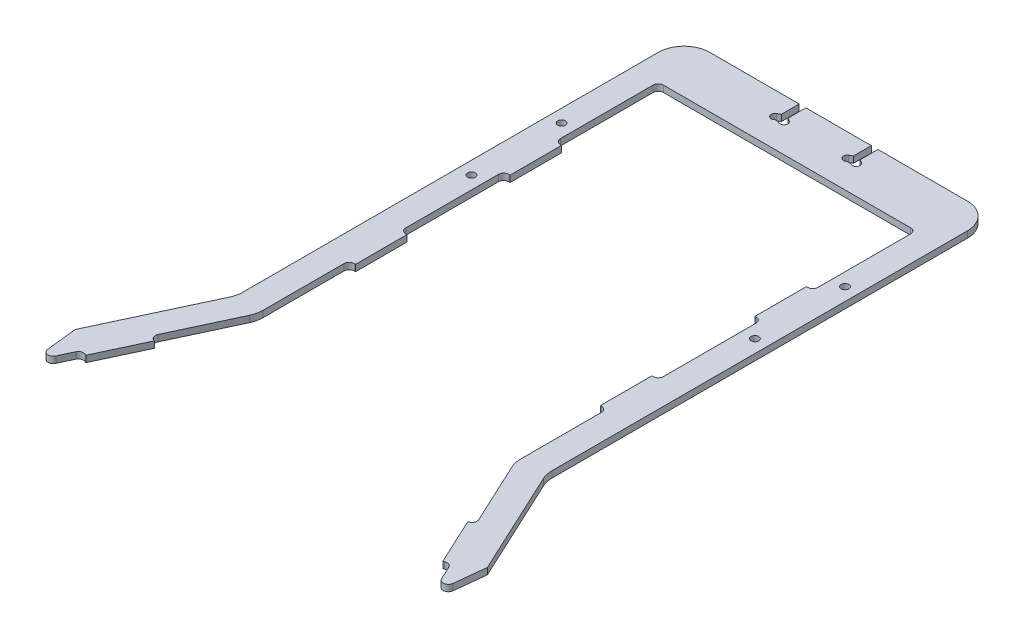
from build123d import *

# Parameters (mm, degrees)
BASE_FLANGE1_DEPTH    = 3.175
SKETCH7_W             = 3.302
SKETCH7_H             = 12.7
CUT_EXTRUDE1_DEPTH    = 326.126156068
SKETCH12_W            = 3.175
SKETCH12_H            = 25.4
TAB1_DEPTH            = 3.175
CUT_EXTRUDE2_DEPTH    = 326.126156068
FILLET1_R             = 2.54
CUT_EXTRUDE3_DEPTH    = 316.848888055
FILLET2_R             = 12.7
FILLET3_R             = 2.54
F_6_CLEARANCE_HOLE1_D = 3.7973


# Sheet-metal steps are written as plain solids
with BuildPart() as part:
    # Sketch1 → Base-Flange1 (new body)
    with BuildSketch(Plane(origin=(0, 0, 0), x_dir=(1, 0, 0), z_dir=(0, 1, 0))):
        Polygon((-76.2, 0), (76.2, 0), (76.2, -220.278764113), (113.110108895, -299.432748076), (101.6, -304.8), (63.5, -223.094286329), (63.5, -25.4), (-63.5, -25.4), (-63.5, -223.094286329), (-101.6, -304.8), (-113.110108895, -299.432748076), (-76.2, -220.278764113), align=None)
    extrude(amount=-BASE_FLANGE1_DEPTH)

    # Sketch7 → Cut-Extrude1 (cut, through all)
    with BuildSketch(Plane(origin=(0, 0, 0), x_dir=(1, 0, 0), z_dir=(0, 1, 0))):
        with Locations((-17.78, -6.35)):
            Rectangle(SKETCH7_W, SKETCH7_H)
        with Locations((17.78, -6.35)):
            Rectangle(SKETCH7_W, SKETCH7_H)
    extrude(amount=-CUT_EXTRUDE1_DEPTH, mode=Mode.SUBTRACT)

    # Sketch12 → Tab1 (add)
    with BuildSketch(Plane(origin=(0, 0, 0), x_dir=(1, 0, 0), z_dir=(0, 1, 0))):
        with Locations((-61.9125, -88.9)):
            Rectangle(SKETCH12_W, SKETCH12_H)
        Polygon((-80.130992304, -258.759564419), (-90.865496152, -281.779782209), (-87.987968928, -283.12159519), (-77.25346508, -260.1013774), align=None)
        with Locations((-61.9125, -165.1)):
            Rectangle(SKETCH12_W, SKETCH12_H)
        Polygon((77.25346508, -260.1013774), (87.987968928, -283.12159519), (90.865496152, -281.779782209), (80.130992304, -258.759564419), align=None)
        with Locations((61.9125, -165.1)):
            Rectangle(SKETCH12_W, SKETCH12_H)
        with Locations((61.9125, -88.9)):
            Rectangle(SKETCH12_W, SKETCH12_H)
    extrude(amount=-TAB1_DEPTH)

    # Sketch13 → Cut-Extrude2 (cut, through all)
    with BuildSketch(Plane(origin=(0, 0, 0), x_dir=(1, 0, 0), z_dir=(0, 1, 0))):
        Polygon((-101.6, -304.8), (-98.916374038, -299.044945552), (-101.6, -274.749239894), (-113.110108895, -299.432748076), align=None)
        Polygon((101.6, -304.8), (98.916374038, -299.044945552), (101.6, -274.749239894), (113.110108895, -299.432748076), align=None)
    extrude(amount=-CUT_EXTRUDE2_DEPTH, mode=Mode.SUBTRACT)

    # Fillet1
    fillet1_edges = [part.edges().sort_by_distance(p)[0] for p in [
        (63.5, -1.5875, 152.4),
        (63.5, -1.5875, 177.8),
        (80.130992304, -1.5875, 258.759564419),
        (90.865496152, -1.5875, 281.779782209),
        (-80.130992304, -1.5875, 258.759564419),
        (-90.865496152, -1.5875, 281.779782209),
        (-63.5, -1.5875, 177.8),
        (-63.5, -1.5875, 152.4),
        (-63.5, -1.5875, 101.6),
        (-63.5, -1.5875, 76.2),
        (63.5, -1.5875, 25.4),
        (-63.5, -1.5875, 25.4),
        (63.5, -1.5875, 76.2),
        (63.5, -1.5875, 101.6),
    ]]
    fillet(fillet1_edges, radius=FILLET1_R)

    # Sketch14 → Cut-Extrude3 (cut, through all)
    with BuildSketch(Plane(origin=(0, 0, 0), x_dir=(1, 0, 0), z_dir=(0, 1, 0))):
        with BuildLine():
            Line((-20.927228778, -9.663103241), (-19.431, -8.799255153))
            Line((-19.431, -8.799255153), (-19.431, -9.487125897))
            ThreePointArc((-19.431, -9.487125897), (-19.752208028, -13.204840809), (-20.927228778, -9.663103241))
        make_face()
        with BuildLine():
            Line((-16.129, -8.799255153), (-16.129, -9.487125897))
            ThreePointArc((-16.129, -9.487125897), (-15.807791972, -13.204840809), (-14.632771222, -9.663103241))
            Line((-14.632771222, -9.663103241), (-16.129, -8.799255153))
        make_face()
        with BuildLine():
            Line((19.431, -8.799255153), (19.431, -9.487125897))
            ThreePointArc((19.431, -9.487125897), (19.752208028, -13.204840809), (20.927228778, -9.663103241))
            Line((20.927228778, -9.663103241), (19.431, -8.799255153))
        make_face()
        with BuildLine():
            Line((14.632771222, -9.663103241), (16.129, -8.799255153))
            Line((16.129, -8.799255153), (16.129, -9.487125897))
            ThreePointArc((16.129, -9.487125897), (15.807791972, -13.204840809), (14.632771222, -9.663103241))
        make_face()
    extrude(amount=-CUT_EXTRUDE3_DEPTH, mode=Mode.SUBTRACT)

    # Fillet2
    fillet2_edges = [part.edges().sort_by_distance(p)[0] for p in [
        (76.2, -1.5875, 220.278764113),
        (63.5, -1.5875, 223.094286329),
        (-63.5, -1.5875, 223.094286329),
        (-76.2, -1.5875, 220.278764113),
        (-76.2, -1.5875, 0),
        (76.2, -1.5875, 0),
    ]]
    fillet(fillet2_edges, radius=FILLET2_R)

    # Fillet3
    fillet3_edges = [part.edges().sort_by_distance(p)[0] for p in [
        (-98.916374038, -1.5875, 299.044945552),
        (98.916374038, -1.5875, 299.044945552),
    ]]
    fillet(fillet3_edges, radius=FILLET3_R)

    # #6 Clearance Hole1 (through all)
    with Locations(Plane(origin=(0, 0, 0), x_dir=(1, 0, 0), z_dir=(0, 1, 0))):
        with Locations((69.85, -66.675), (69.85, -111.125), (-69.85, -111.125), (-69.85, -66.675)):
            Hole(F_6_CLEARANCE_HOLE1_D / 2)


solid = part.part
